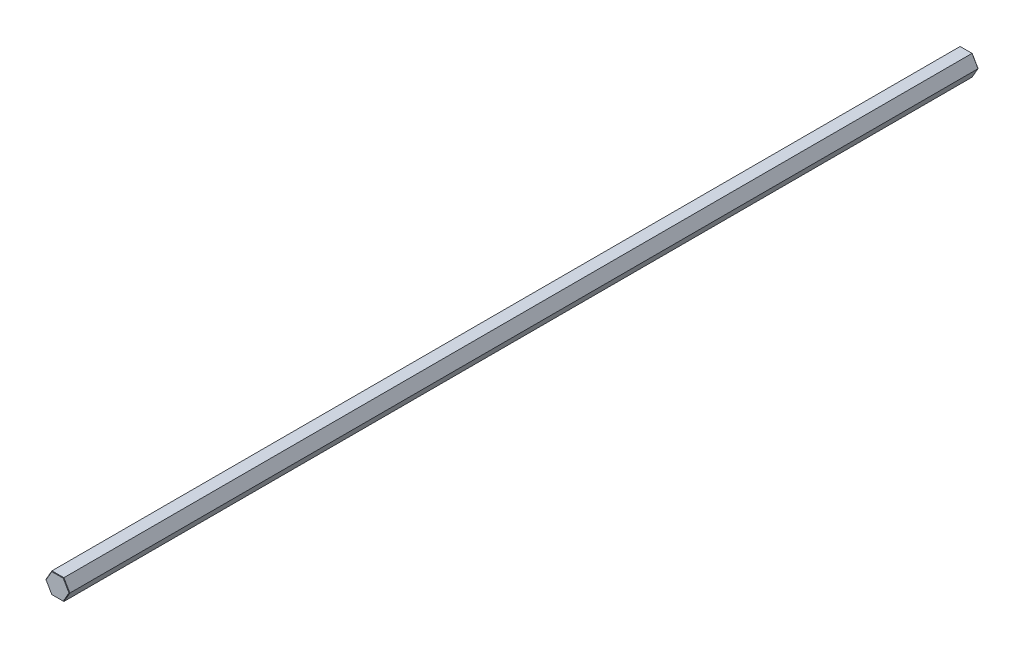
from build123d import *

# Parameters (mm, degrees)
BOSS_EXTRUDE1_DEPTH = 558.8
CHAMFER1_SIZE       = 0.254


with BuildPart() as part:
    # Sketch1 → Boss-Extrude1 (new body)
    with BuildSketch(Plane(origin=(0, 0, 0), x_dir=(-1, 0, 0), z_dir=(0, 0, -1))):
        Polygon((3.666174209, 6.35), (-3.666174209, 6.35), (-7.332348419, 0), (-3.666174209, -6.35), (3.666174209, -6.35), (7.332348419, 0), align=None)
    extrude(amount=-BOSS_EXTRUDE1_DEPTH)

    # Chamfer1
    chamfer1_edges = [part.edges().sort_by_distance(p)[0] for p in [
        (0, -6.35, 0),
        (5.499261314, -3.175, 0),
        (-5.499261314, -3.175, 0),
        (5.499261314, 3.175, 0),
        (-5.499261314, 3.175, 0),
        (0, 6.35, 0),
        (-5.499261314, -3.175, 558.8),
        (0, -6.35, 558.8),
        (-5.499261314, 3.175, 558.8),
        (5.499261314, -3.175, 558.8),
        (0, 6.35, 558.8),
        (5.499261314, 3.175, 558.8),
    ]]
    chamfer(chamfer1_edges, length=CHAMFER1_SIZE)


solid = part.part
